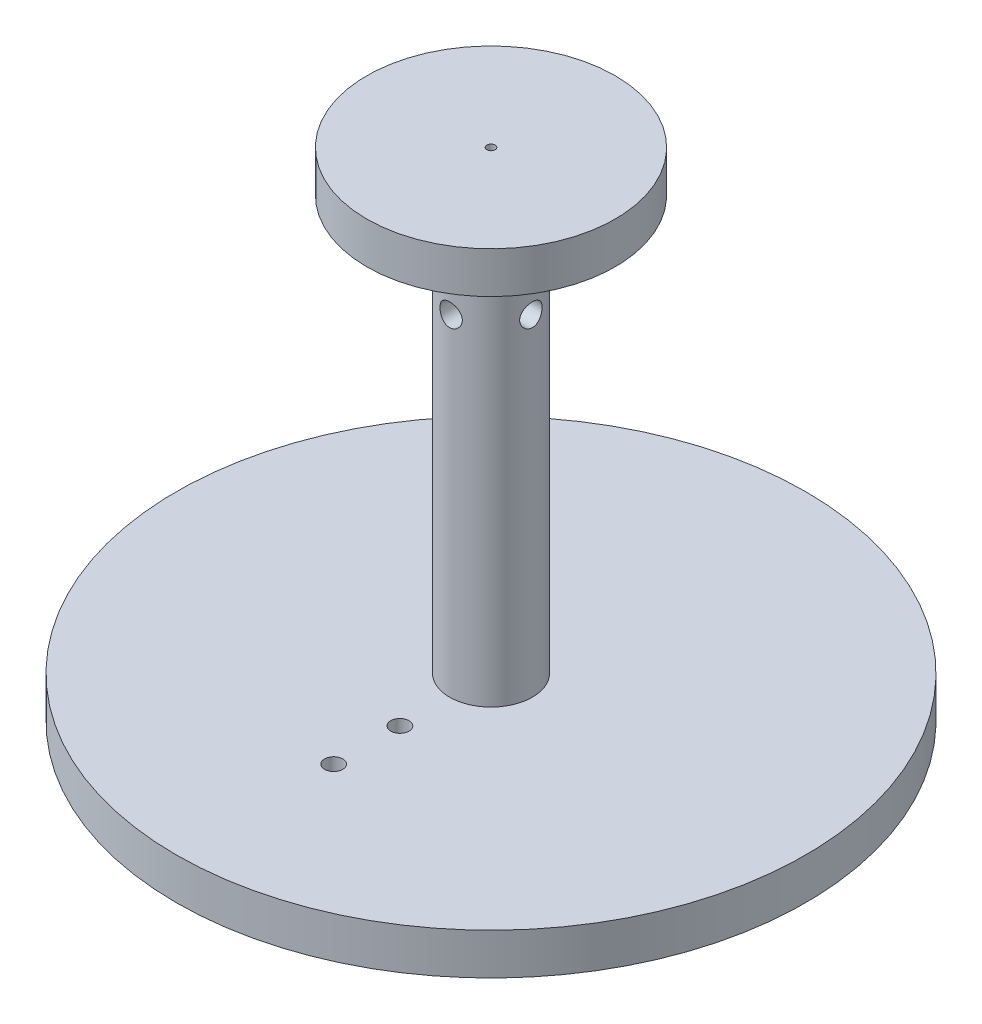
from build123d import *

# Parameters (mm, degrees)
F_1_0MM_1_D                    = 2.2
F_1_0MM_1_DEPTH                = 5
F_1_0MM_2_OUTLINE_R            = 1.35
F_1_0MM_2_DEPTH                = 6
PATTERN_START                  = -6
PATTERN_CIRCULAR_2_DEPTH       = 6
PATTERN_START_2                = -0.353553391
PATTERN_CIRCULAR_2_2_OUTLINE_R = 1.35
PATTERN_CIRCULAR_2_2_DEPTH     = 6.353553391
PATTERN_CIRCULAR_2_3_OUTLINE_R = 1.35
PATTERN_CIRCULAR_2_3_DEPTH     = 5.075
F_1_0MM_3_REACH                = 85.024
F_1_0MM_3_BORE_R               = 1.35
PATTERN_CIRCULAR_3_COUNT       = 4


with BuildPart() as part:
    # 草圖1 → 旋轉1 (revolve)
    with BuildSketch(Plane(origin=(0, 0, 0), x_dir=(0, 0, -1), z_dir=(1, 0, 0))):
        Polygon((5, 0), (38, 0), (38, 5), (5, 5), (5, 55), (15, 55), (15, 60), (0.5, 60), (0.5, 40), (0, 40), (0, 5), (2.5, 5), (2.5, -10), (5, -10), align=None)
    revolve(axis=Axis((0, 5, 0), (0, 1, 0)))

    # Ø1.0mm 定位孔1
    with Locations(Plane(origin=(0, 5, 0), x_dir=(1, 0, 0), z_dir=(0, 1, 0))):
        with Locations((0, -11), (0, -19)):
            Hole(F_1_0MM_1_D / 2, depth=F_1_0MM_1_DEPTH)

    # Ø1.0mm 定位孔2: read off the stored shape, not the designer's step
    # Ø1.0mm 定位孔2 outline → Ø1.0mm 定位孔2 (cut)
    with BuildSketch(Plane.XY):
        with Locations((0, 45)):
            Circle(F_1_0MM_2_OUTLINE_R)
    extrude(amount=F_1_0MM_2_DEPTH, mode=Mode.SUBTRACT)

    # 環狀複製排列2: read off the stored shape, not the designer's step
    # 環狀複製排列2 outline → 環狀複製排列2 (cut)
    with BuildSketch(Plane.XY.offset(PATTERN_START)):
        with BuildLine():
            ThreePointArc((-0.925, 45.983298022), (-1.35, 45), (-0.925, 44.016701978))
            ThreePointArc((-0.925, 44.016701978), (-0.658944559, 43.821741935), (-0.353553142, 43.69711851))
            ThreePointArc((-0.353553142, 43.69711851), (1.35, 45.000000077), (-0.353553291, 46.302881449))
            ThreePointArc((-0.353553291, 46.302881449), (-0.658944627, 46.178258027), (-0.925, 45.983298022))
        make_face()
    extrude(amount=PATTERN_CIRCULAR_2_DEPTH, mode=Mode.SUBTRACT)

    # Pattern Circular 2 2 outline → Pattern Circular 2 2 (cut)
    with BuildSketch(Plane.YZ.offset(PATTERN_START_2)):
        with Locations((45, 0)):
            Circle(PATTERN_CIRCULAR_2_2_OUTLINE_R)
    extrude(amount=PATTERN_CIRCULAR_2_2_DEPTH, mode=Mode.SUBTRACT)

    # Pattern Circular 2 3 outline → Pattern Circular 2 3 (cut)
    with BuildSketch(Plane.YZ.offset(PATTERN_START)):
        with Locations((45, 0)):
            Circle(PATTERN_CIRCULAR_2_3_OUTLINE_R)
    extrude(amount=PATTERN_CIRCULAR_2_3_DEPTH, mode=Mode.SUBTRACT)

    # Ø1.0mm 定位孔3 bore → Ø1.0mm 定位孔3 (cut, up to next)
    with BuildSketch(Plane.XY.offset(5), mode=Mode.PRIVATE) as f_1_0mm_3_sk1:
        with Locations((0, -5)):
            Circle(F_1_0MM_3_BORE_R)
    f_1_0mm_3_tool1 = extrude(f_1_0mm_3_sk1.sketch, amount=-F_1_0MM_3_REACH, mode=Mode.PRIVATE) & part.part
    f_1_0mm_3 = f_1_0mm_3_tool1.solids().sort_by_distance((0, -5, 5))[0]
    add(f_1_0mm_3, mode=Mode.SUBTRACT)

    # 環狀複製排列3: Ø1.0mm 定位孔3 ×4 about axis
    pattern_circular_3_axis = Axis((0, 5, 0), (0, -1, 0))
    for i in range(1, PATTERN_CIRCULAR_3_COUNT):
        add(f_1_0mm_3.rotate(pattern_circular_3_axis, i * 360 / PATTERN_CIRCULAR_3_COUNT), mode=Mode.SUBTRACT)


solid = part.part
